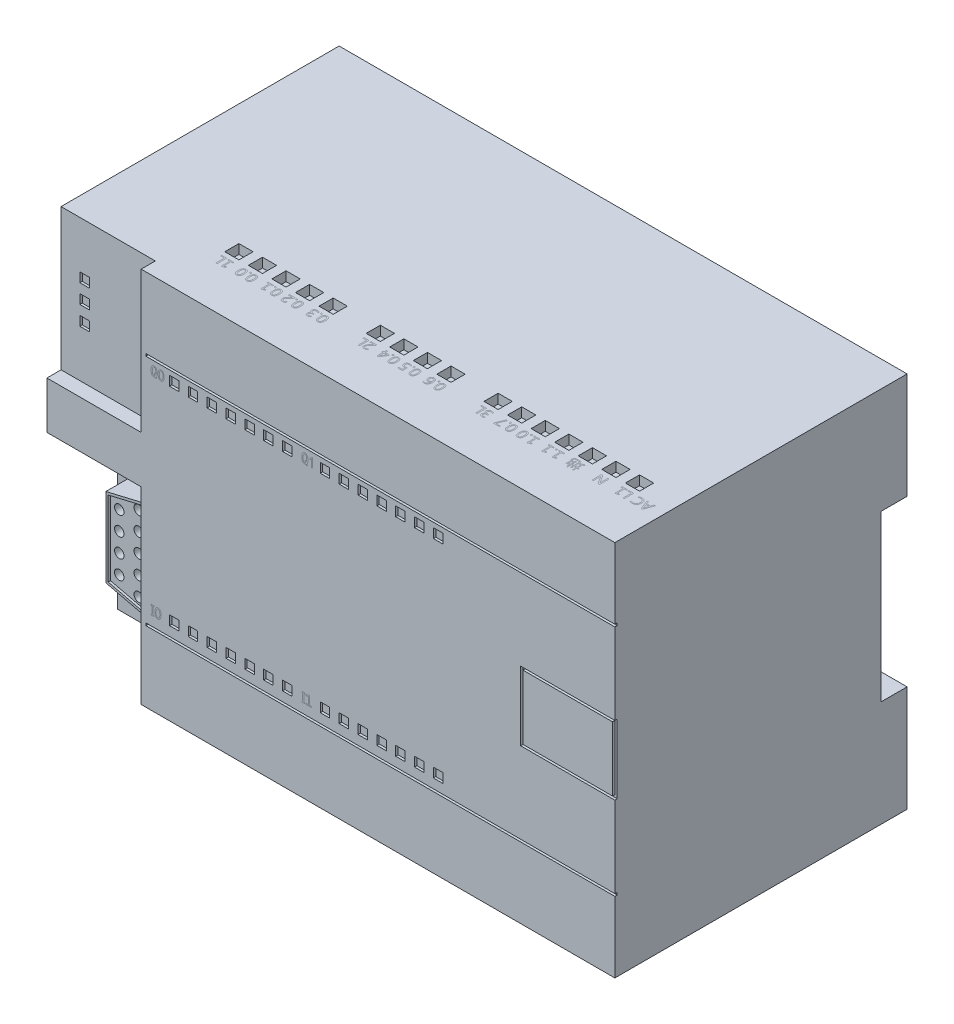
from build123d import *

# Parameters (mm, degrees)
EXTRUDE_1_DEPTH      = 120.5
SKETCH_2_W           = 20
SKETCH_2_H           = 40
CUT_EXTRUDE_1_DEPTH  = 15
SKETCH_2_4_W         = 20
SKETCH_2_4_H         = 14.644787542
SKETCH_2_4_W_2       = 19
SKETCH_2_4_H_2       = 13.644787542
SKETCH_2_4_W_3       = 99.5
SKETCH_2_4_H_3       = 0.5
SKETCH_2_4_W_4       = 2
SKETCH_2_4_H_4       = 2
CUT_EXTRUDE_2_DEPTH  = 0.5
SKETCH_2_5_W         = 20
SKETCH_2_5_H         = 30
CUT_EXTRUDE_3_DEPTH  = 3
SKETCH_2_6_W         = 2
SKETCH_2_6_H         = 2
CUT_EXTRUDE_4_DEPTH  = 3.5
CUT_EXTRUDE_5_DEPTH  = 13
SKETCH_2_8_R         = 2
CUT_EXTRUDE_6_DEPTH  = 15
SKETCH_2_9_R         = 1
CUT_EXTRUDE_7_DEPTH  = 15
CUT_EXTRUDE_8_DEPTH  = 7.5
CUT_EXTRUDE_9_DEPTH  = 7
SKETCH_4_W           = 3
SKETCH_4_H           = 3
CUT_EXTRUDE_10_DEPTH = 2
SKETCH_5_W           = 3
SKETCH_5_H           = 3
CUT_EXTRUDE_11_DEPTH = 2


with BuildPart() as part:
    # 草图1 → 凸台-拉伸1 (new body)
    with BuildSketch(Plane(origin=(0, 0, 0), x_dir=(0, 0, -1), z_dir=(1, 0, 0))):
        Polygon((62, -57.5), (62, -80), (0, -80), (0, 0), (62, 0), (62, -22.5), (56.5, -22.5), (56.5, -57.5), align=None)
    extrude(amount=EXTRUDE_1_DEPTH)

    # 草图2 → 切除-拉伸1 (cut)
    with BuildSketch(Plane.XY):
        with Locations((10, -60)):
            Rectangle(SKETCH_2_W, SKETCH_2_H)
        Polygon((7, -49.013480083), (7, -44.013480083), (13, -44.013480083), (13, -49.013480083), (15, -49.013480083), (15, -70.986519917), (13, -70.986519917), (13, -75.986519917), (7, -75.986519917), (7, -70.986519917), (5, -70.986519917), (5, -49.013480083), align=None, mode=Mode.SUBTRACT)
    extrude(amount=-CUT_EXTRUDE_1_DEPTH, mode=Mode.SUBTRACT)

    # 草图2<4> → 切除-拉伸2 (cut)
    # profile 1 of 31: a face of its own
    with BuildSketch(Plane.XY):
        with Locations((110.5, -40)):
            Rectangle(SKETCH_2_4_W, SKETCH_2_4_H)
        with Locations((110.5, -40)):
            Rectangle(SKETCH_2_4_W_2, SKETCH_2_4_H_2, mode=Mode.SUBTRACT)
    # profile 2 of 31: a face of its own
    with BuildSketch(Plane.XY):
        with Locations((70.75, -15.25)):
            Rectangle(SKETCH_2_4_W_3, SKETCH_2_4_H_3)
    # profile 3 of 31: a face of its own
    with BuildSketch(Plane.XY):
        with Locations((70.75, -64.75)):
            Rectangle(SKETCH_2_4_W_3, SKETCH_2_4_H_3)
    # profile 4 of 31: a face of its own
    with BuildSketch(Plane.XY):
        with Locations((31, -61.5)):
            Rectangle(SKETCH_2_4_W_4, SKETCH_2_4_H_4)
    # profile 5 of 31: a face of its own
    with BuildSketch(Plane.XY):
        with Locations((27, -61.5)):
            Rectangle(SKETCH_2_4_W_4, SKETCH_2_4_H_4)
    # profile 6 of 31: a face of its own
    with BuildSketch(Plane.XY):
        with Locations((35, -61.5)):
            Rectangle(SKETCH_2_4_W_4, SKETCH_2_4_H_4)
    # profile 7 of 31: a face of its own
    with BuildSketch(Plane.XY):
        with Locations((39, -61.5)):
            Rectangle(SKETCH_2_4_W_4, SKETCH_2_4_H_4)
    # profile 8 of 31: a face of its own
    with BuildSketch(Plane.XY):
        with Locations((43, -61.5)):
            Rectangle(SKETCH_2_4_W_4, SKETCH_2_4_H_4)
    # profile 9 of 31: a face of its own
    with BuildSketch(Plane.XY):
        with Locations((47, -61.5)):
            Rectangle(SKETCH_2_4_W_4, SKETCH_2_4_H_4)
    # profile 10 of 31: a face of its own
    with BuildSketch(Plane.XY):
        with Locations((51, -61.5)):
            Rectangle(SKETCH_2_4_W_4, SKETCH_2_4_H_4)
    # profile 11 of 31: a face of its own
    with BuildSketch(Plane.XY):
        with Locations((59, -61.5)):
            Rectangle(SKETCH_2_4_W_4, SKETCH_2_4_H_4)
    # profile 12 of 31: a face of its own
    with BuildSketch(Plane.XY):
        with Locations((63, -61.5)):
            Rectangle(SKETCH_2_4_W_4, SKETCH_2_4_H_4)
    # profile 13 of 31: a face of its own
    with BuildSketch(Plane.XY):
        with Locations((67, -61.5)):
            Rectangle(SKETCH_2_4_W_4, SKETCH_2_4_H_4)
    # profile 14 of 31: a face of its own
    with BuildSketch(Plane.XY):
        with Locations((71, -61.5)):
            Rectangle(SKETCH_2_4_W_4, SKETCH_2_4_H_4)
    # profile 15 of 31: a face of its own
    with BuildSketch(Plane.XY):
        with Locations((75, -61.5)):
            Rectangle(SKETCH_2_4_W_4, SKETCH_2_4_H_4)
    # profile 16 of 31: a face of its own
    with BuildSketch(Plane.XY):
        with Locations((79, -61.5)):
            Rectangle(SKETCH_2_4_W_4, SKETCH_2_4_H_4)
    # profile 17 of 31: a face of its own
    with BuildSketch(Plane.XY):
        with Locations((83, -61.5)):
            Rectangle(SKETCH_2_4_W_4, SKETCH_2_4_H_4)
    # profile 18 of 31: a face of its own
    with BuildSketch(Plane.XY):
        with Locations((31, -17.5)):
            Rectangle(SKETCH_2_4_W_4, SKETCH_2_4_H_4)
    # profile 19 of 31: a face of its own
    with BuildSketch(Plane.XY):
        with Locations((35, -17.5)):
            Rectangle(SKETCH_2_4_W_4, SKETCH_2_4_H_4)
    # profile 20 of 31: a face of its own
    with BuildSketch(Plane.XY):
        with Locations((39, -17.5)):
            Rectangle(SKETCH_2_4_W_4, SKETCH_2_4_H_4)
    # profile 21 of 31: a face of its own
    with BuildSketch(Plane.XY):
        with Locations((43, -17.5)):
            Rectangle(SKETCH_2_4_W_4, SKETCH_2_4_H_4)
    # profile 22 of 31: a face of its own
    with BuildSketch(Plane.XY):
        with Locations((47, -17.5)):
            Rectangle(SKETCH_2_4_W_4, SKETCH_2_4_H_4)
    # profile 23 of 31: a face of its own
    with BuildSketch(Plane.XY):
        with Locations((51, -17.5)):
            Rectangle(SKETCH_2_4_W_4, SKETCH_2_4_H_4)
    # profile 24 of 31: a face of its own
    with BuildSketch(Plane.XY):
        with Locations((59, -17.5)):
            Rectangle(SKETCH_2_4_W_4, SKETCH_2_4_H_4)
    # profile 25 of 31: a face of its own
    with BuildSketch(Plane.XY):
        with Locations((63, -17.5)):
            Rectangle(SKETCH_2_4_W_4, SKETCH_2_4_H_4)
    # profile 26 of 31: a face of its own
    with BuildSketch(Plane.XY):
        with Locations((67, -17.5)):
            Rectangle(SKETCH_2_4_W_4, SKETCH_2_4_H_4)
    # profile 27 of 31: a face of its own
    with BuildSketch(Plane.XY):
        with Locations((71, -17.5)):
            Rectangle(SKETCH_2_4_W_4, SKETCH_2_4_H_4)
    # profile 28 of 31: a face of its own
    with BuildSketch(Plane.XY):
        with Locations((75, -17.5)):
            Rectangle(SKETCH_2_4_W_4, SKETCH_2_4_H_4)
    # profile 29 of 31: a face of its own
    with BuildSketch(Plane.XY):
        with Locations((79, -17.5)):
            Rectangle(SKETCH_2_4_W_4, SKETCH_2_4_H_4)
    # profile 30 of 31: a face of its own
    with BuildSketch(Plane.XY):
        with Locations((83, -17.5)):
            Rectangle(SKETCH_2_4_W_4, SKETCH_2_4_H_4)
    # profile 31 of 31: a face of its own
    with BuildSketch(Plane.XY):
        with Locations((27, -17.5)):
            Rectangle(SKETCH_2_4_W_4, SKETCH_2_4_H_4)
    extrude(amount=-CUT_EXTRUDE_2_DEPTH, mode=Mode.SUBTRACT)

    # 草图2<5> → 切除-拉伸3 (cut)
    with BuildSketch(Plane.XY):
        with Locations((10, -15)):
            Rectangle(SKETCH_2_5_W, SKETCH_2_5_H)
    extrude(amount=-CUT_EXTRUDE_3_DEPTH, mode=Mode.SUBTRACT)

    # 草图2<6> → 切除-拉伸4 (cut)
    with BuildSketch(Plane.XY):
        with Locations((5, -15)):
            Rectangle(SKETCH_2_6_W, SKETCH_2_6_H)
        with Locations((5, -11)):
            Rectangle(SKETCH_2_6_W, SKETCH_2_6_H)
        with Locations((5, -19)):
            Rectangle(SKETCH_2_6_W, SKETCH_2_6_H)
    extrude(amount=-CUT_EXTRUDE_4_DEPTH, mode=Mode.SUBTRACT)

    # 草图2<7> → 切除-拉伸5 (cut)
    with BuildSketch(Plane.XY):
        Polygon((7, -49.013480083), (7, -44.013480083), (13, -44.013480083), (13, -49.013480083), (15, -49.013480083), (15, -70.986519917), (13, -70.986519917), (13, -75.986519917), (7, -75.986519917), (7, -70.986519917), (5, -70.986519917), (5, -49.013480083), align=None)
        Polygon((5.5, -51.60431894), (14.5, -49.479050457), (14.5, -70.520949543), (5.5, -68.39568106), align=None, mode=Mode.SUBTRACT)
    extrude(amount=-CUT_EXTRUDE_5_DEPTH, mode=Mode.SUBTRACT)

    # 草图2<8> → 切除-拉伸6 (cut)
    with BuildSketch(Plane.XY):
        with Locations((10, -47.013480083)):
            Circle(SKETCH_2_8_R)
        with Locations((10, -72.986519917)):
            Circle(SKETCH_2_8_R)
    extrude(amount=-CUT_EXTRUDE_6_DEPTH, mode=Mode.SUBTRACT)

    # 草图2<9> → 切除-拉伸7 (cut)
    with BuildSketch(Plane.XY):
        with Locations((7.850312497, -54)):
            Circle(SKETCH_2_9_R)
        with Locations((7.850312497, -58)):
            Circle(SKETCH_2_9_R)
        with Locations((7.850312497, -62)):
            Circle(SKETCH_2_9_R)
        with Locations((7.850312497, -66)):
            Circle(SKETCH_2_9_R)
        with Locations((11.979833633, -52)):
            Circle(SKETCH_2_9_R)
        with Locations((11.979833633, -56)):
            Circle(SKETCH_2_9_R)
        with Locations((11.979833633, -60)):
            Circle(SKETCH_2_9_R)
        with Locations((11.979833633, -64)):
            Circle(SKETCH_2_9_R)
        with Locations((11.979833633, -68)):
            Circle(SKETCH_2_9_R)
    extrude(amount=-CUT_EXTRUDE_7_DEPTH, mode=Mode.SUBTRACT)

    # 草图2<10> → 切除-拉伸8 (cut)
    with BuildSketch(Plane.XY):
        Polygon((6, -52), (6, -68), (14, -69.88912754), (14, -50.11087246), align=None)
    extrude(amount=-CUT_EXTRUDE_8_DEPTH, mode=Mode.SUBTRACT)

    # 草图2<11> → 切除-拉伸9 (cut)
    with BuildSketch(Plane.XY):
        Polygon((5.5, -51.60431894), (14.5, -49.479050457), (14.5, -70.520949543), (5.5, -68.39568106), align=None)
    extrude(amount=-CUT_EXTRUDE_9_DEPTH, mode=Mode.SUBTRACT)

    # 草图4 → 切除-拉伸10 (cut)
    with BuildSketch(Plane.XZ.offset(80)):
        with Locations((32.1687947, -13.566222237)):
            Rectangle(SKETCH_4_W, SKETCH_4_H)
        with Locations((27.1687947, -13.566222237)):
            Rectangle(SKETCH_4_W, SKETCH_4_H)
        with Locations((37.1687947, -13.566222237)):
            Rectangle(SKETCH_4_W, SKETCH_4_H)
        with Locations((42.1687947, -13.566222237)):
            Rectangle(SKETCH_4_W, SKETCH_4_H)
        with Locations((47.1687947, -13.566222237)):
            Rectangle(SKETCH_4_W, SKETCH_4_H)
        with Locations((52.1687947, -13.566222237)):
            Rectangle(SKETCH_4_W, SKETCH_4_H)
        with Locations((57.1687947, -13.566222237)):
            Rectangle(SKETCH_4_W, SKETCH_4_H)
        with Locations((62.1687947, -13.566222237)):
            Rectangle(SKETCH_4_W, SKETCH_4_H)
        with Locations((67.1687947, -13.566222237)):
            Rectangle(SKETCH_4_W, SKETCH_4_H)
        with Locations((72.1687947, -13.566222237)):
            Rectangle(SKETCH_4_W, SKETCH_4_H)
        with Locations((77.1687947, -13.566222237)):
            Rectangle(SKETCH_4_W, SKETCH_4_H)
        with Locations((82.1687947, -13.566222237)):
            Rectangle(SKETCH_4_W, SKETCH_4_H)
        with Locations((87.1687947, -13.566222237)):
            Rectangle(SKETCH_4_W, SKETCH_4_H)
        with Locations((92.1687947, -13.566222237)):
            Rectangle(SKETCH_4_W, SKETCH_4_H)
        with Locations((97.1687947, -13.566222237)):
            Rectangle(SKETCH_4_W, SKETCH_4_H)
        with Locations((102.1687947, -13.566222237)):
            Rectangle(SKETCH_4_W, SKETCH_4_H)
        with Locations((107.1687947, -13.566222237)):
            Rectangle(SKETCH_4_W, SKETCH_4_H)
        with Locations((112.1687947, -13.566222237)):
            Rectangle(SKETCH_4_W, SKETCH_4_H)
    extrude(amount=-CUT_EXTRUDE_10_DEPTH, mode=Mode.SUBTRACT)

    # 草图5 → 切除-拉伸11 (cut)
    with BuildSketch(Plane(origin=(0, 0, 0), x_dir=(1, 0, 0), z_dir=(0, 1, 0))):
        with Locations((27.1687947, 13.566222237)):
            Rectangle(SKETCH_5_W, SKETCH_5_H)
        with Locations((32.1687947, 13.566222237)):
            Rectangle(SKETCH_5_W, SKETCH_5_H)
        with Locations((37.1687947, 13.566222237)):
            Rectangle(SKETCH_5_W, SKETCH_5_H)
        with Locations((42.1687947, 13.566222237)):
            Rectangle(SKETCH_5_W, SKETCH_5_H)
        with Locations((47.1687947, 13.566222237)):
            Rectangle(SKETCH_5_W, SKETCH_5_H)
        with Locations((57.1687947, 13.566222237)):
            Rectangle(SKETCH_5_W, SKETCH_5_H)
        with Locations((62.1687947, 13.566222237)):
            Rectangle(SKETCH_5_W, SKETCH_5_H)
        with Locations((67.1687947, 13.566222237)):
            Rectangle(SKETCH_5_W, SKETCH_5_H)
        with Locations((72.1687947, 13.566222237)):
            Rectangle(SKETCH_5_W, SKETCH_5_H)
        with Locations((82.1687947, 13.566222237)):
            Rectangle(SKETCH_5_W, SKETCH_5_H)
        with Locations((87.1687947, 13.566222237)):
            Rectangle(SKETCH_5_W, SKETCH_5_H)
        with Locations((92.1687947, 13.566222237)):
            Rectangle(SKETCH_5_W, SKETCH_5_H)
        with Locations((97.1687947, 13.566222237)):
            Rectangle(SKETCH_5_W, SKETCH_5_H)
        with Locations((102.1687947, 13.566222237)):
            Rectangle(SKETCH_5_W, SKETCH_5_H)
        with Locations((107.1687947, 13.566222237)):
            Rectangle(SKETCH_5_W, SKETCH_5_H)
        with Locations((112.1687947, 13.566222237)):
            Rectangle(SKETCH_5_W, SKETCH_5_H)
    extrude(amount=-CUT_EXTRUDE_11_DEPTH, mode=Mode.SUBTRACT)


solid = part.part
